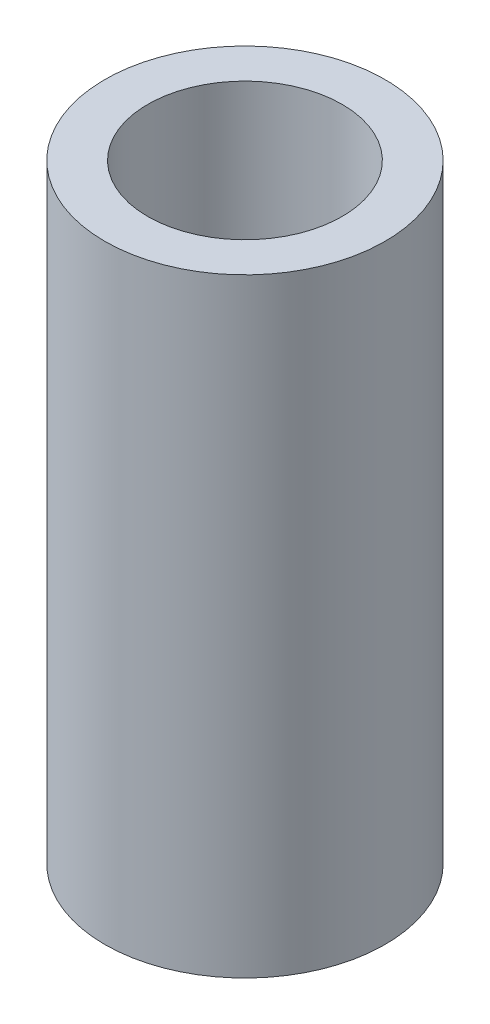
from build123d import *

# Parameters (mm, degrees)
SKETCH1_R           = 17.5
BOSS_EXTRUDE1_DEPTH = 76.045153867
SKETCH2_R           = 12.136601841
CUT_EXTRUDE1_DEPTH  = 80.97102867


with BuildPart() as part:
    # Sketch1 → Boss-Extrude1 (new body)
    with BuildSketch(Plane(origin=(0, 0, 0), x_dir=(1, 0, 0), z_dir=(0, 1, 0))):
        Circle(SKETCH1_R)
    extrude(amount=BOSS_EXTRUDE1_DEPTH)

    # Sketch2 → Cut-Extrude1 (cut, through all)
    with BuildSketch(Plane(origin=(0, 0, 0), x_dir=(1, 0, 0), z_dir=(0, 1, 0))):
        Circle(SKETCH2_R)
    extrude(amount=CUT_EXTRUDE1_DEPTH, mode=Mode.SUBTRACT)


solid = part.part
